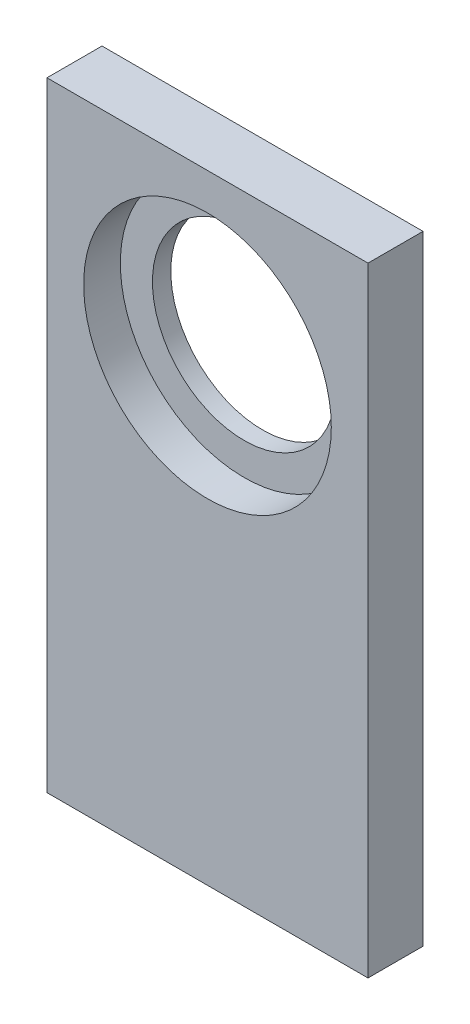
from build123d import *

# Parameters (mm, degrees)
BOSS_EXTRUDE1_DEPTH = 6
SKETCH4_R           = 13.5
CUT_EXTRUDE1_DEPTH  = 4
SKETCH5_R           = 10
CUT_EXTRUDE2_DEPTH  = 47.135669498


with BuildPart() as part:
    # Sketch1 → Boss-Extrude1 (new body)
    with BuildSketch(Plane.XY):
        Polygon((-17.5, 25), (-17.5, 42.5), (17.5, 42.5), (17.5, 25), (17.5, -25), (-17.5, -25), align=None)
    extrude(amount=BOSS_EXTRUDE1_DEPTH)

    # Sketch4 → Cut-Extrude1 (cut)
    with BuildSketch(Plane.XY.offset(6)):
        with Locations((0, 25)):
            Circle(SKETCH4_R)
    extrude(amount=-CUT_EXTRUDE1_DEPTH, mode=Mode.SUBTRACT)

    # Sketch5 → Cut-Extrude2 (cut, through all)
    with BuildSketch(Plane.XY.offset(2)):
        with Locations((0, 25)):
            Circle(SKETCH5_R)
    extrude(amount=-CUT_EXTRUDE2_DEPTH, mode=Mode.SUBTRACT)


solid = part.part
